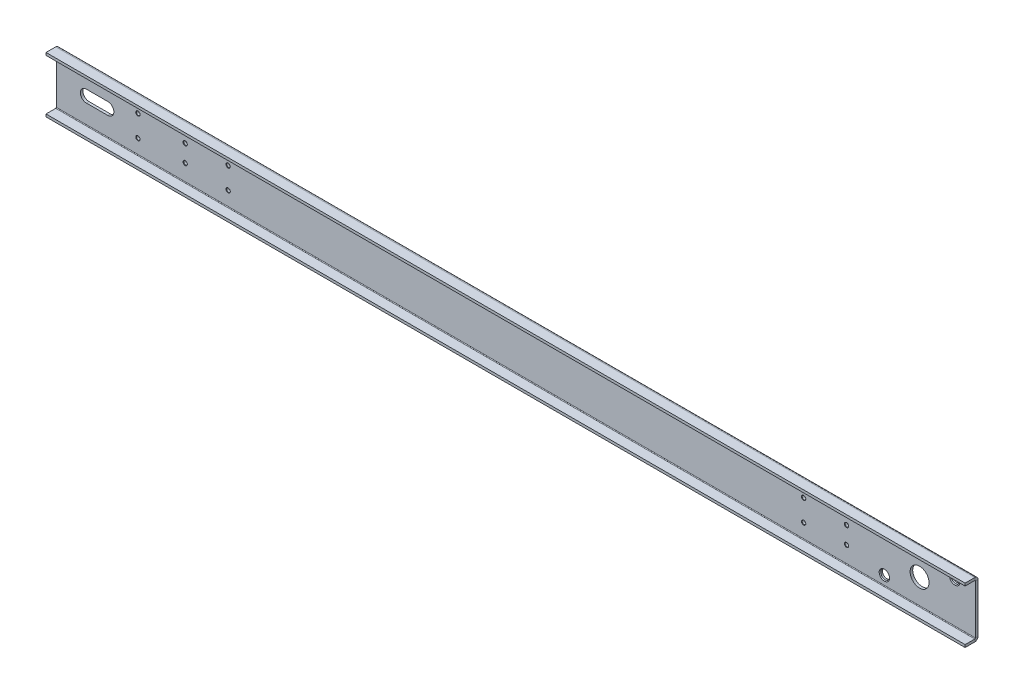
from build123d import *

# Parameters (mm, degrees)
BASE_FLANGE1_DEPTH          = 535
CUT_EXTRUDE1_DEPTH          = 537.120555472
M5_TAPPED_HOLE1_D           = 4.2
M5_TAPPED_HOLE1_CSINK_D     = 5.05
M5_TAPPED_HOLE1_CSINK_ANGLE = 90
M5_TAPPED_HOLE2_D           = 4.2
M5_TAPPED_HOLE2_CSINK_D     = 5.05
M5_TAPPED_HOLE2_CSINK_ANGLE = 90
M5_TAPPED_HOLE3_D           = 4.2
M5_TAPPED_HOLE3_CSINK_D     = 5.05
M5_TAPPED_HOLE3_CSINK_ANGLE = 90
SKETCH16_R                  = 11
CUT_EXTRUDE2_DEPTH          = 537.120555472
M12_TAPPED_HOLE1_AT_2_COUNT = 2
M12_TAPPED_HOLE1_AT_2_PITCH = 90


# Sheet-metal steps are written as plain solids
with BuildPart() as part:
    # Sketch1 → Base-Flange1 (new, symmetric)
    with BuildSketch(Plane(origin=(0, 0, 0), x_dir=(0, 0, -1), z_dir=(1, 0, 0))):
        with BuildLine():
            Line((-15, -32.5), (-3.7366, -32.5))
            ThreePointArc((-3.7366, -32.5), (-1.094424801, -31.405575199), (0, -28.7634))
            Line((0, -28.7634), (0, 28.7634))
            ThreePointArc((0, 28.7634), (-1.094424801, 31.405575199), (-3.7366, 32.5))
            Line((-3.7366, 32.5), (-15, 32.5))
            Line((-15, 32.5), (-15, 29.5))
            Line((-15, 29.5), (-3.7366, 29.5))
            ThreePointArc((-3.7366, 29.5), (-3.215745145, 29.284254855), (-3, 28.7634))
            Line((-3, 28.7634), (-3, -28.7634))
            ThreePointArc((-3, -28.7634), (-3.215745145, -29.284254855), (-3.7366, -29.5))
            Line((-3.7366, -29.5), (-15, -29.5))
            Line((-15, -29.5), (-15, -32.5))
        make_face()
    extrude(amount=BASE_FLANGE1_DEPTH, both=True)

    # Sketch6 → Cut-Extrude1 (cut, through all)
    with BuildSketch(Plane.XY.offset(3)):
        with BuildLine():
            Line((-500, 7), (-475, 7))
            ThreePointArc((-475, 7), (-468, 0), (-475, -7))
            Line((-475, -7), (-500, -7))
            ThreePointArc((-500, -7), (-507, 0), (-500, 7))
        make_face()
    extrude(amount=-CUT_EXTRUDE1_DEPTH, mode=Mode.SUBTRACT)

    # M5 Tapped Hole1 (through all)
    with Locations(Plane.XY.offset(3)):
        with Locations((-440, 12.5), (-440, -12.5)):
            CounterSinkHole(M5_TAPPED_HOLE1_D / 2, M5_TAPPED_HOLE1_CSINK_D / 2, counter_sink_angle=M5_TAPPED_HOLE1_CSINK_ANGLE)

    # M5 Tapped Hole2 (through all)
    with Locations(Plane.XY.offset(3)):
        with Locations((-385, 10), (-385, -10)):
            m5_tapped_hole2 = CounterSinkHole(M5_TAPPED_HOLE2_D / 2, M5_TAPPED_HOLE2_CSINK_D / 2, counter_sink_angle=M5_TAPPED_HOLE2_CSINK_ANGLE)

    # M5 Tapped Hole3 (through all)
    with Locations(Plane.XY.offset(3)):
        with Locations((-335, 12.5), (-335, -12.5)):
            m5_tapped_hole3 = CounterSinkHole(M5_TAPPED_HOLE3_D / 2, M5_TAPPED_HOLE3_CSINK_D / 2, counter_sink_angle=M5_TAPPED_HOLE3_CSINK_ANGLE)

    # Mirror1: M5 Tapped Hole2, M5 Tapped Hole3 across plane
    add(m5_tapped_hole2.mirror(Plane(origin=(0, 0, 0), x_dir=(0, 0, 1), z_dir=(1, 0, 0))), mode=Mode.SUBTRACT)
    add(m5_tapped_hole3.mirror(Plane(origin=(0, 0, 0), x_dir=(0, 0, 1), z_dir=(1, 0, 0))), mode=Mode.SUBTRACT)

    # Sketch16 → Cut-Extrude2 (cut, through all)
    with BuildSketch(Plane.XY.offset(3)):
        with Locations((470, 0)):
            Circle(SKETCH16_R)
    extrude(amount=-CUT_EXTRUDE2_DEPTH, mode=Mode.SUBTRACT)

    # Sketch20 → M12 Tapped Hole1 (revolve, cut)
    with BuildSketch(Plane(origin=(428.977162095, -18.496669166, 3), x_dir=(0, -1, 0), z_dir=(1, 0, 0))):
        Polygon((0, 0), (0, 3), (5.1, 3), (5.1, 0.925), (6.025, 0), align=None)
    m12_tapped_hole1 = revolve(axis=Axis((428.977162095, -18.496669166, 9.35), (0, 0, -1)), mode=Mode.SUBTRACT)

    # M12 Tapped Hole1 at 2: M12 Tapped Hole1 ×2
    with Locations(*[Vector(0.9116186201067192, 0.4110370925776907, 0) * (i * M12_TAPPED_HOLE1_AT_2_PITCH) for i in range(1, M12_TAPPED_HOLE1_AT_2_COUNT)]):
        add(m12_tapped_hole1, mode=Mode.SUBTRACT)


solid = part.part
